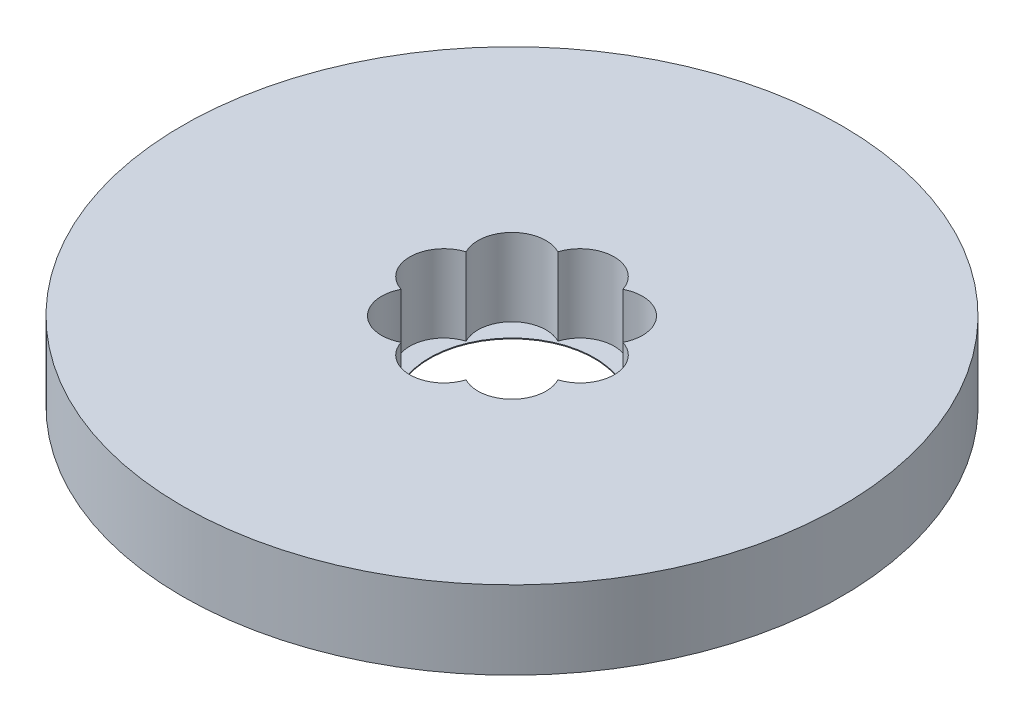
from build123d import *

# Parameters (mm, degrees)
SKETCH1_R           = 80
BOSS_EXTRUDE1_DEPTH = 19
SKETCH2_R           = 20
CUT_EXTRUDE1_DEPTH  = 115.721401665
SKETCH3_R           = 8.271230521
CUT_EXTRUDE2_DEPTH  = 18.790390573
CIRPATTERN1_COUNT   = 8


with BuildPart() as part:
    # Sketch1 → Boss-Extrude1 (new body)
    with BuildSketch(Plane(origin=(0, 0, 0), x_dir=(1, 0, 0), z_dir=(0, 1, 0))):
        Circle(SKETCH1_R)
    extrude(amount=BOSS_EXTRUDE1_DEPTH)

    # Sketch2 → Cut-Extrude1 (cut, through all)
    with BuildSketch(Plane(origin=(0, 0, 0), x_dir=(1, 0, 0), z_dir=(0, 1, 0))):
        Circle(SKETCH2_R)
    extrude(amount=CUT_EXTRUDE1_DEPTH, mode=Mode.SUBTRACT)

    # Sketch3 → Cut-Extrude2 (cut)
    with BuildSketch(Plane(origin=(0, 19, 0), x_dir=(1, 0, 0), z_dir=(0, 1, 0))):
        with Locations((-16.536495709, 0)):
            Circle(SKETCH3_R)
    cut_extrude2 = extrude(amount=-CUT_EXTRUDE2_DEPTH, mode=Mode.SUBTRACT)

    # CirPattern1: Cut-Extrude2 ×8 about axis
    cirpattern1_axis = Axis((0, 0, 0), (0, 1, 0))
    for i in range(1, CIRPATTERN1_COUNT):
        add(cut_extrude2.rotate(cirpattern1_axis, i * 360 / CIRPATTERN1_COUNT), mode=Mode.SUBTRACT)


solid = part.part
